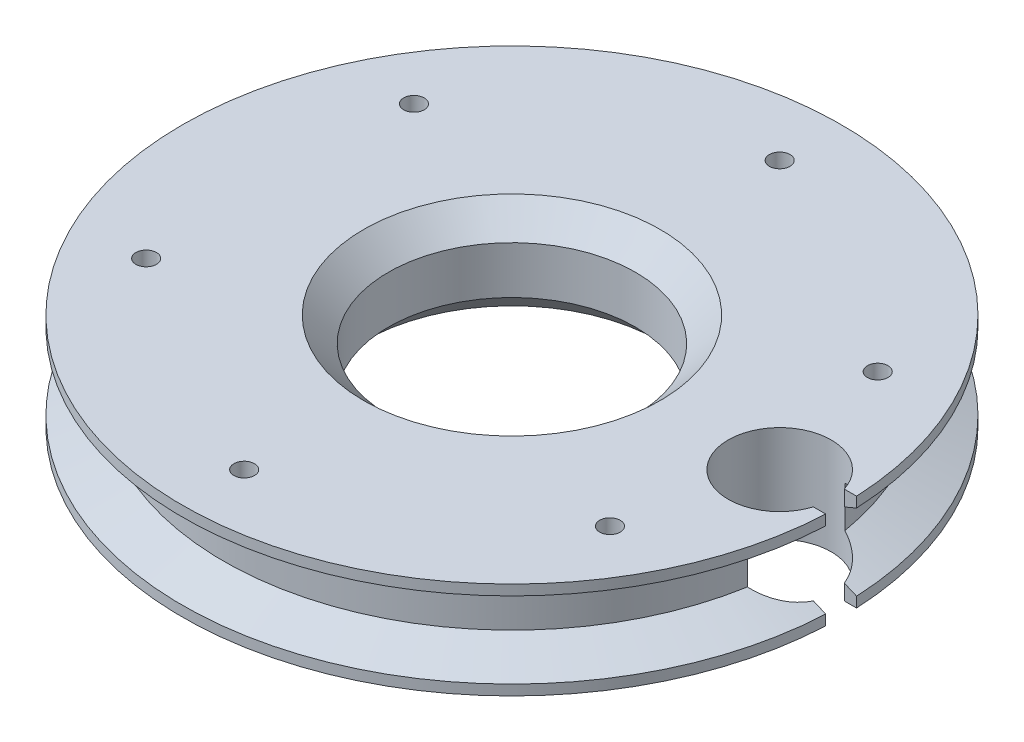
from build123d import *

# Parameters (mm, degrees)
CORTE_EXTRUS_O1_DEPTH      = 10
CHANFRO3_SIZE              = 1.2
CORTE_EXTRUS_O2_DEPTH      = 24.1114675
CORTE_EXTRUS_O2_DEPTH_BACK = 24.1114675
ESBO_O5_R                  = 0.5


with BuildPart() as part:
    # Esboço2 → Revolução1 (revolve)
    with BuildSketch(Plane.XY):
        Polygon((6, 0), (16, 0), (16, 0.5), (14, 1.352653961), (14, 3.352653961), (16, 4.205307923), (16, 4.705307923), (6, 4.705307923), align=None)
    revolve(axis=Axis((0, 0, 0), (0, 1, 0)))

    # Esboço3 → Corte-extrusão1 (cut)
    with BuildSketch(Plane.XZ):
        with BuildLine():
            Line((16.115047023, 0.75), (16.115047023, -0.75))
            Line((16.115047023, -0.75), (15.384848004, -0.75))
            ThreePointArc((15.384848004, -0.75), (10.5, 0), (15.384848004, 0.75))
            Line((15.384848004, 0.75), (16.115047023, 0.75))
        make_face()
    extrude(amount=-CORTE_EXTRUS_O1_DEPTH, mode=Mode.SUBTRACT)

    # Chanfro3
    chanfro3_edges = [part.edges().sort_by_distance(p)[0] for p in [
        (-6, 0, 0),
        (-6, 4.705307923, 0),
    ]]
    chamfer(chanfro3_edges, length=CHANFRO3_SIZE)

    # Esboço5 → Corte-extrusão2 (cut, two sides: drawn at the far end of the back side and taken through both)
    with BuildSketch(Plane(origin=(0, 4.705307923, 0), x_dir=(1, 0, 0), z_dir=(0, 1, 0)).offset(-CORTE_EXTRUS_O2_DEPTH_BACK)):
        with Locations((0, 13)):
            Circle(ESBO_O5_R)
        with Locations((0, -13)):
            Circle(ESBO_O5_R)
        with Locations((11.258330249, 6.5)):
            Circle(ESBO_O5_R)
        with Locations((-11.258330249, -6.5)):
            Circle(ESBO_O5_R)
        with Locations((11.258330249, -6.5)):
            Circle(ESBO_O5_R)
        with Locations((-11.258330249, 6.5)):
            Circle(ESBO_O5_R)
    extrude(amount=CORTE_EXTRUS_O2_DEPTH + CORTE_EXTRUS_O2_DEPTH_BACK, mode=Mode.SUBTRACT)


solid = part.part
